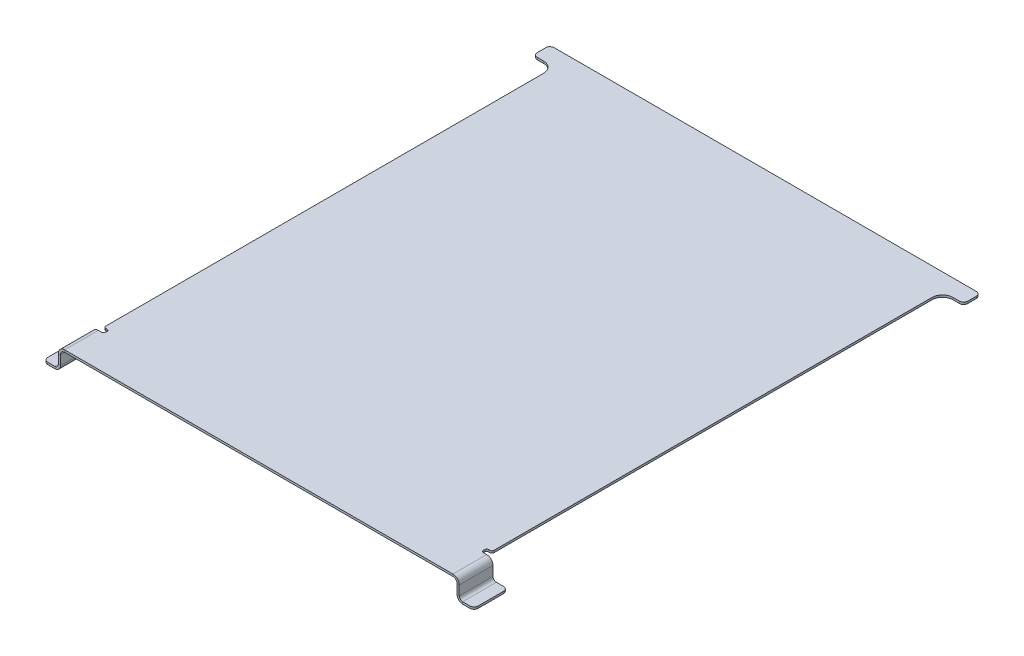
from build123d import *

# Parameters (mm, degrees)
SKETCH5_W                      = 301.625
SKETCH5_H                      = 1.5875
BASE_FLANGE1_DEPTH             = 381
SKETCH10_W                     = 11.1125
SKETCH10_H                     = 12.7
BOSS_EXTRUDE1_DEPTH            = 1.5875
EDGE_FLANGE1_STRIP_W           = 12.7
EDGE_FLANGE1_STRIP_H           = 1.5875
EDGE_FLANGE1_STRIP_CUT_DEPTH   = 368.3
EDGE_FLANGE1_STRIP_2_W         = 12.7
EDGE_FLANGE1_STRIP_2_H         = 1.5875
EDGE_FLANGE1_STRIP_CUT_2_DEPTH = 368.3
EDGE_FLANGE1_DEPTH             = 368.3
EDGE_FLANGE1_BEND_DEPTH        = 368.3
CUT_EXTRUDE1_START             = -25.4
CUT_EXTRUDE1_DEPTH             = 342.9
EDGE_FLANGE2_STRIP_W           = 11.43
EDGE_FLANGE2_STRIP_H           = 1.5875
EDGE_FLANGE2_STRIP_CUT_DEPTH   = 25.4
EDGE_FLANGE2_DEPTH             = 25.4
EDGE_FLANGE3_STRIP_W           = 11.43
EDGE_FLANGE3_STRIP_H           = 1.5875
EDGE_FLANGE3_STRIP_CUT_DEPTH   = 25.4
EDGE_FLANGE3_DEPTH             = 25.4
FILLET1_R                      = 8
FILLET2_R                      = 3.175
SKETCH30_W                     = 4
SKETCH30_H                     = 1.5875
CUT_EXTRUDE9_DEPTH             = 4
SKETCH31_W                     = 4
SKETCH31_H                     = 1.5875
CUT_EXTRUDE10_DEPTH            = 4
FILLET4_R                      = 1.5


# Sheet-metal steps are written as plain solids
with BuildPart() as part:
    # Sketch5 → Base-Flange1 (new body)
    with BuildSketch(Plane.XY):
        with Locations((0, -0.79375)):
            Rectangle(SKETCH5_W, SKETCH5_H)
    extrude(amount=BASE_FLANGE1_DEPTH)

    # Sketch10 → Boss-Extrude1 (add)
    with BuildSketch(Plane(origin=(0, 0, 0), x_dir=(1, 0, 0), z_dir=(0, 1, 0))):
        with Locations((-156.36875, -6.35)):
            Rectangle(SKETCH10_W, SKETCH10_H)
        with Locations((156.36875, -6.35)):
            Rectangle(SKETCH10_W, SKETCH10_H)
    extrude(amount=-BOSS_EXTRUDE1_DEPTH)

    # Edge-Flange1 strip (across the edge) → Edge-Flange1 strip cut (cut)
    with BuildSketch(Plane(origin=(150.8125, -1.5875, 12.7), x_dir=(-1, 0, 0), z_dir=(0, 0, 1))):
        with Locations((-1.5875, -0.79375)):
            Rectangle(EDGE_FLANGE1_STRIP_W, EDGE_FLANGE1_STRIP_H)
    extrude(amount=EDGE_FLANGE1_STRIP_CUT_DEPTH, mode=Mode.SUBTRACT)

    # Edge-Flange1 strip 2 (across the edge) → Edge-Flange1 strip cut 2 (cut)
    with BuildSketch(Plane(origin=(-150.8125, -1.5875, 381), x_dir=(1, 0, 0), z_dir=(0, 0, -1))):
        with Locations((-1.5875, -0.79375)):
            Rectangle(EDGE_FLANGE1_STRIP_2_W, EDGE_FLANGE1_STRIP_2_H)
    extrude(amount=EDGE_FLANGE1_STRIP_CUT_2_DEPTH, mode=Mode.SUBTRACT)

    # Edge-Flange1 section (across the edge) → Edge-Flange1 (add)
    with BuildSketch(Plane(origin=(150.8125, -1.5875, 12.7), x_dir=(-1, 0, 0), z_dir=(0, 0, 1))):
        with BuildLine():
            Line((0, 3.175), (0, 14.4125))
            Line((0, 14.4125), (1.5875, 14.4125))
            Line((1.5875, 14.4125), (1.5875, 3.175))
            ThreePointArc((1.5875, 3.175), (2.51743597, 0.92993597), (4.7625, 0))
            Line((4.7625, 0), (4.7625, -1.5875))
            ThreePointArc((4.7625, -1.5875), (1.394903955, -0.192596045), (0, 3.175))
        make_face()
    extrude(amount=EDGE_FLANGE1_DEPTH)

    # Edge-Flange1 section 2 (across the edge) → Edge-Flange1 bend (add)
    with BuildSketch(Plane(origin=(-150.8125, -1.5875, 381), x_dir=(1, 0, 0), z_dir=(0, 0, -1))):
        with BuildLine():
            Line((0, 3.175), (0, 14.4125))
            Line((0, 14.4125), (1.5875, 14.4125))
            Line((1.5875, 14.4125), (1.5875, 3.175))
            ThreePointArc((1.5875, 3.175), (2.51743597, 0.92993597), (4.7625, 0))
            Line((4.7625, 0), (4.7625, -1.5875))
            ThreePointArc((4.7625, -1.5875), (1.394903955, -0.192596045), (0, 3.175))
        make_face()
    extrude(amount=EDGE_FLANGE1_BEND_DEPTH)

    # Sketch20 → Cut-Extrude1 (cut)
    with BuildSketch(Plane.XY.offset(381).offset(CUT_EXTRUDE1_START)):
        with BuildLine():
            Line((-150.8125, -4.7625), (-150.8125, -16))
            Line((-150.8125, -16), (-149.225, -16))
            Line((-149.225, -16), (-149.225, -4.7625))
            ThreePointArc((-149.225, -4.7625), (-148.29506403, -2.51743597), (-146.05, -1.5875))
            Line((-146.05, -1.5875), (-146.05, 0))
            ThreePointArc((-146.05, 0), (-149.417596045, -1.394903955), (-150.8125, -4.7625))
        make_face()
        with BuildLine():
            Line((149.225, -4.7625), (149.225, -16))
            Line((149.225, -16), (150.8125, -16))
            Line((150.8125, -16), (150.8125, -4.7625))
            ThreePointArc((150.8125, -4.7625), (149.417596045, -1.394903955), (146.05, 0))
            Line((146.05, 0), (146.05, -1.5875))
            ThreePointArc((146.05, -1.5875), (148.29506403, -2.51743597), (149.225, -4.7625))
        make_face()
    extrude(amount=-CUT_EXTRUDE1_DEPTH, mode=Mode.SUBTRACT)

    # Edge-Flange2 strip (across the edge) → Edge-Flange2 strip cut (cut)
    with BuildSketch(Plane(origin=(-150.8125, -16, 355.6), x_dir=(0, 1, 0), z_dir=(0, 0, 1))):
        with Locations((-1.5875, -0.79375)):
            Rectangle(EDGE_FLANGE2_STRIP_W, EDGE_FLANGE2_STRIP_H)
    extrude(amount=EDGE_FLANGE2_STRIP_CUT_DEPTH, mode=Mode.SUBTRACT)

    # Edge-Flange2 section (across the edge) → Edge-Flange2 (add)
    with BuildSketch(Plane(origin=(-150.8125, -16, 355.6), x_dir=(0, 1, 0), z_dir=(0, 0, 1))):
        with BuildLine():
            Line((0, 2.54), (0, 11.1125))
            Line((0, 11.1125), (1.5875, 11.1125))
            Line((1.5875, 11.1125), (1.5875, 2.54))
            ThreePointArc((1.5875, 2.54), (2.331448776, 0.743948776), (4.1275, 0))
            Line((4.1275, 0), (4.1275, -1.5875))
            ThreePointArc((4.1275, -1.5875), (1.208916761, -0.378583239), (0, 2.54))
        make_face()
    extrude(amount=EDGE_FLANGE2_DEPTH)

    # Edge-Flange3 strip (across the edge) → Edge-Flange3 strip cut (cut)
    with BuildSketch(Plane(origin=(150.8125, -16, 381), x_dir=(0, 1, 0), z_dir=(0, 0, -1))):
        with Locations((-1.5875, -0.79375)):
            Rectangle(EDGE_FLANGE3_STRIP_W, EDGE_FLANGE3_STRIP_H)
    extrude(amount=EDGE_FLANGE3_STRIP_CUT_DEPTH, mode=Mode.SUBTRACT)

    # Edge-Flange3 section (across the edge) → Edge-Flange3 (add)
    with BuildSketch(Plane(origin=(150.8125, -16, 381), x_dir=(0, 1, 0), z_dir=(0, 0, -1))):
        with BuildLine():
            Line((0, 2.54), (0, 11.1125))
            Line((0, 11.1125), (1.5875, 11.1125))
            Line((1.5875, 11.1125), (1.5875, 2.54))
            ThreePointArc((1.5875, 2.54), (2.331448776, 0.743948776), (4.1275, 0))
            Line((4.1275, 0), (4.1275, -1.5875))
            ThreePointArc((4.1275, -1.5875), (1.208916761, -0.378583239), (0, 2.54))
        make_face()
    extrude(amount=EDGE_FLANGE3_DEPTH)

    # Fillet1
    fillet1_edges = [part.edges().sort_by_distance(p)[0] for p in [
        (-146.05, -0.79375, 12.7),
        (146.05, -0.79375, 12.7),
    ]]
    fillet(fillet1_edges, radius=FILLET1_R)

    # Fillet2
    fillet2_edges = [part.edges().sort_by_distance(p)[0] for p in [
        (-161.925, -0.79375, 12.7),
        (-161.925, -0.79375, 0),
        (-161.925, -15.20625, 355.6),
        (-161.925, -15.20625, 381),
        (161.925, -15.20625, 381),
        (161.925, -15.20625, 355.6),
        (161.925, -0.79375, 0),
        (161.925, -0.79375, 12.7),
    ]]
    fillet(fillet2_edges, radius=FILLET2_R)

    # Sketch30 → Cut-Extrude9 (cut)
    with BuildSketch(Plane.ZY.offset(146.05)):
        with Locations((353.6, -0.79375)):
            Rectangle(SKETCH30_W, SKETCH30_H)
    extrude(amount=-CUT_EXTRUDE9_DEPTH, mode=Mode.SUBTRACT)

    # Sketch31 → Cut-Extrude10 (cut)
    with BuildSketch(Plane(origin=(146.05, 0, 0), x_dir=(0, 0, -1), z_dir=(1, 0, 0))):
        with Locations((-353.6, -0.79375)):
            Rectangle(SKETCH31_W, SKETCH31_H)
    extrude(amount=-CUT_EXTRUDE10_DEPTH, mode=Mode.SUBTRACT)

    # Fillet4
    fillet4_edges = [part.edges().sort_by_distance(p)[0] for p in [
        (-146.05, -0.79375, 351.6),
        (-142.05, -0.79375, 351.6),
        (-142.05, -0.79375, 355.6),
        (146.05, -0.79375, 351.6),
        (142.05, -0.79375, 351.6),
        (142.05, -0.79375, 355.6),
    ]]
    fillet(fillet4_edges, radius=FILLET4_R)


solid = part.part
